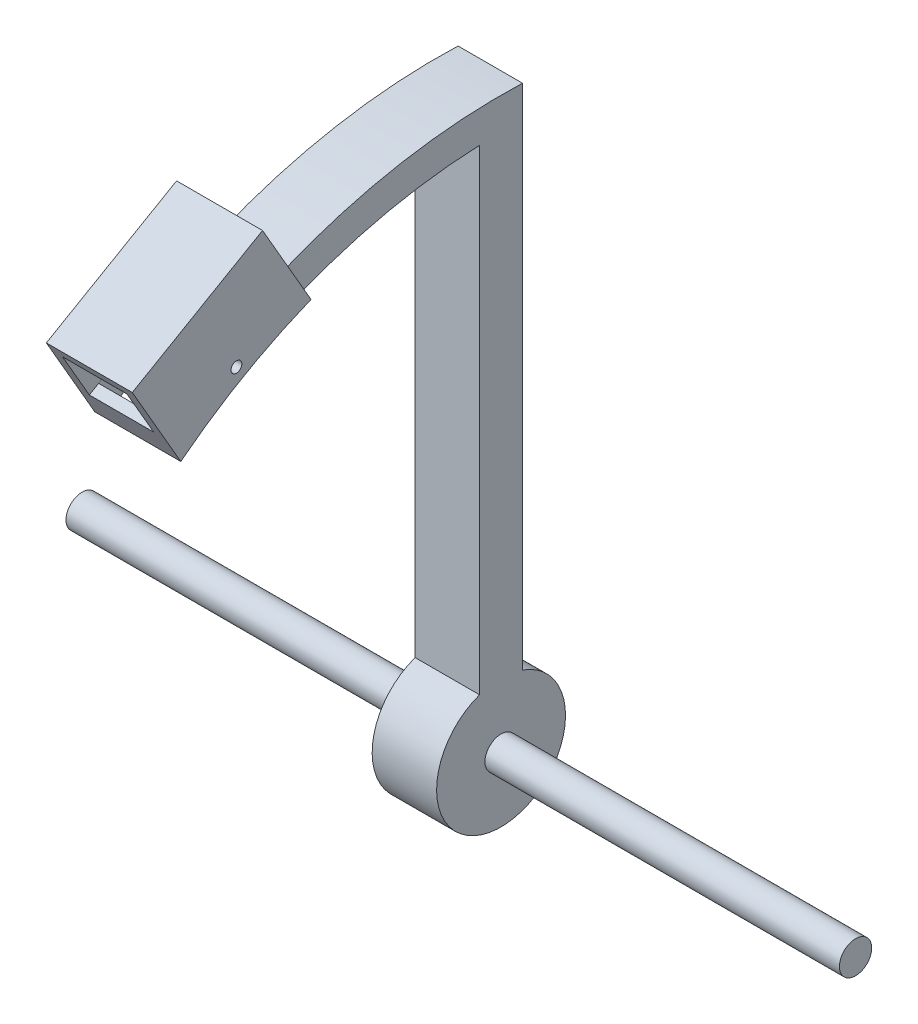
from build123d import *
from build123d.topology import SkipClean

# Parameters (mm, degrees)
BOSS_EXTRUDE1_DEPTH             = 15
BOSS_EXTRUDE1_DEPTH_BACK        = 15
BOSS_EXTRUDE3_REACH             = 306.228
BOSS_EXTRUDE3_END_RADIUS        = 250
SKETCH5_W                       = 40
SKETCH5_H                       = 70
BOSS_EXTRUDE3_DIRECTION_2_DEPTH = 30
SKETCH6_W                       = 30
SKETCH6_H                       = 25
CUT_EXTRUDE2_DEPTH              = 70
CUT_EXTRUDE3_REACH              = 306.515
CUT_EXTRUDE3_END_RADIUS         = 250
SKETCH7_W                       = 30.021890818
SKETCH7_H                       = 60
CUT_EXTRUDE4_REACH              = 327.352
SKETCH8_R                       = 2.5
CUT_EXTRUDE4_DIRECTION_2_REACH  = 327.352
BOSS_EXTRUDE4_DEPTH             = 180
BOSS_EXTRUDE4_DEPTH_BACK        = 180
SKETCH11_R                      = 7.5


with BuildPart() as part:
    # Sketch1 → Boss-Extrude1 (new, two sides: drawn at the far end of the back side and taken through both)
    with BuildSketch(Plane(origin=(0, 0, 0), x_dir=(0, 0, -1), z_dir=(1, 0, 0)).offset(-BOSS_EXTRUDE1_DEPTH_BACK)):
        with BuildLine():
            Line((10, 28.284271247), (10, 264.811253537))
            ThreePointArc((10, 264.811253537), (-46.581095136, 260.873918926), (-101.028366233, 244.986263322))
            Line((-101.028366233, 244.986263322), (-161.650144498, 209.986263322))
            Line((-161.650144498, 209.986263322), (-152.500136319, 198.100248417))
            ThreePointArc((-152.500136319, 198.100248417), (-85.263049352, 235.011089984), (-10, 249.799919936))
            Line((-10, 249.799919936), (-10, 28.284271247))
            ThreePointArc((-10, 28.284271247), (0, -30), (10, 28.284271247))
        make_face()
    extrude(amount=BOSS_EXTRUDE1_DEPTH + BOSS_EXTRUDE1_DEPTH_BACK)

    # Boss-Extrude3: up to this cylinder (the profile starts outside it)
    with SkipClean():  # the faces are left unmerged after this step: merging them gives an invalid solid
        boss_extrude3_end = Plane(origin=(0, 0, 0), z_dir=(-1, 0, 0)) * Cylinder(BOSS_EXTRUDE3_END_RADIUS, 1113.456, mode=Mode.PRIVATE)
        # Sketch5 → Boss-Extrude3 (add, up to the surface)
        with BuildSketch(Plane(origin=(0, 227.486263322, 131.339255366), x_dir=(1, 0, 0), z_dir=(0, 0.8660254037844353, 0.5000000000000059)), mode=Mode.PRIVATE) as boss_extrude3_sk1:
            Rectangle(SKETCH5_W, SKETCH5_H)
        boss_extrude3_tool1 = extrude(boss_extrude3_sk1.sketch, amount=-BOSS_EXTRUDE3_REACH, mode=Mode.PRIVATE) - boss_extrude3_end
        add(boss_extrude3_tool1.solids().sort_by_distance((0, 227.486263, 131.339255))[0])

    # Sketch5 → Boss-Extrude3 direction 2 (add)
    with SkipClean():  # the faces are left unmerged after this step: merging them gives an invalid solid
        with BuildSketch(Plane(origin=(0, 227.486263322, 131.339255366), x_dir=(1, 0, 0), z_dir=(0, 0.8660254037844353, 0.5000000000000059))):
            Rectangle(SKETCH5_W, SKETCH5_H)
        extrude(amount=BOSS_EXTRUDE3_DIRECTION_2_DEPTH)

    # Sketch6 → Cut-Extrude2 (cut)
    with SkipClean():  # the faces are left unmerged after this step: merging them gives an invalid solid
        with BuildSketch(Plane(origin=(0, 17.5, -30.310889132), x_dir=(-1, 0, 0), z_dir=(0, 0.5000000000000059, -0.8660254037844353))):
            with Locations((0, 275.178510731)):
                Rectangle(SKETCH6_W, SKETCH6_H)
        extrude(amount=-CUT_EXTRUDE2_DEPTH, mode=Mode.SUBTRACT)

    # Cut-Extrude3: up to this cylinder (the profile starts outside it)
    cut_extrude3_end = Plane(origin=(0, 0, 0), z_dir=(-1, 0, 0)) * Cylinder(CUT_EXTRUDE3_END_RADIUS, 1114.03, mode=Mode.PRIVATE)
    # Sketch7 → Cut-Extrude3 (cut, up to the surface)
    with BuildSketch(Plane(origin=(0, 227.486263322, 131.339255366), x_dir=(1, 0, 0), z_dir=(0, 0.8660254037844353, 0.5000000000000059)), mode=Mode.PRIVATE) as cut_extrude3_sk1:
        Rectangle(SKETCH7_W, SKETCH7_H)
    cut_extrude3_tool1 = extrude(cut_extrude3_sk1.sketch, amount=-CUT_EXTRUDE3_REACH, mode=Mode.PRIVATE) - cut_extrude3_end
    add(cut_extrude3_tool1.solids().sort_by_distance((0, 227.486263, 131.339255))[0], mode=Mode.SUBTRACT)

    # Cut-Extrude4: up to this face of the body (flat: up to its plane)
    cut_extrude4_end = Plane(part.part.faces().sort_by_distance((-20, 234.626657577, 135.461763911))[0])
    # Sketch8 → Cut-Extrude4 (cut, up to the picked face)
    with BuildSketch(Plane(origin=(-15.010945409, 0, 0), x_dir=(0, 0, -1), z_dir=(1, 0, 0)), mode=Mode.PRIVATE) as cut_extrude4_sk1:
        with Locations((-128.169627683, 221.996307134)):
            Circle(SKETCH8_R)
    cut_extrude4_tool1 = split(extrude(cut_extrude4_sk1.sketch, amount=-CUT_EXTRUDE4_REACH, mode=Mode.PRIVATE), bisect_by=cut_extrude4_end, keep=Keep.BOTH, mode=Mode.PRIVATE)
    add(cut_extrude4_tool1.solids().sort_by(Axis((-15.010945, 221.996307, 128.169628), (-1, 0, 0)))[0], mode=Mode.SUBTRACT)

    # Cut-Extrude4 direction 2: up to this face of the body (flat: up to its plane)
    cut_extrude4_direction_2_end = Plane(part.part.faces().sort_by_distance((20, 234.626657577, 135.461763911))[0])
    # Sketch8 → Cut-Extrude4 direction 2 (cut, up to the picked face)
    with BuildSketch(Plane(origin=(-15.010945409, 0, 0), x_dir=(0, 0, -1), z_dir=(1, 0, 0)), mode=Mode.PRIVATE) as cut_extrude4_direction_2_sk1:
        with Locations((-128.169627683, 221.996307134)):
            Circle(SKETCH8_R)
    cut_extrude4_direction_2_tool1 = split(extrude(cut_extrude4_direction_2_sk1.sketch, amount=CUT_EXTRUDE4_DIRECTION_2_REACH, mode=Mode.PRIVATE), bisect_by=cut_extrude4_direction_2_end, keep=Keep.BOTH, mode=Mode.PRIVATE)
    add(cut_extrude4_direction_2_tool1.solids().sort_by(Axis((-15.010945, 221.996307, 128.169628), (1, 0, 0)))[0], mode=Mode.SUBTRACT)

    # Sketch11 → Boss-Extrude4 (add, two sides: drawn at the far end of the back side and taken through both)
    with BuildSketch(Plane(origin=(0, 0, 0), x_dir=(0, 0, -1), z_dir=(1, 0, 0)).offset(-BOSS_EXTRUDE4_DEPTH_BACK)):
        Circle(SKETCH11_R)
    extrude(amount=BOSS_EXTRUDE4_DEPTH + BOSS_EXTRUDE4_DEPTH_BACK)


solid = part.part
